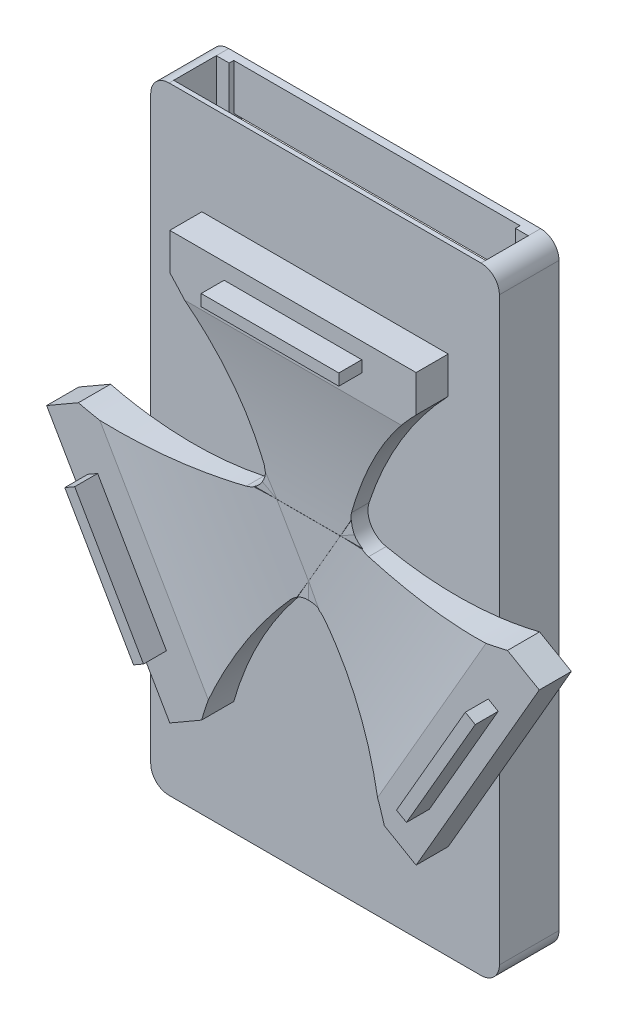
from build123d import *

# Parameters (mm, degrees)
RESSALTO_EXTRUS_O1_DEPTH = 7
RESSALTO_EXTRUS_O2_DEPTH = 5
RESSALTO_EXTRUS_O3_DEPTH = 13
CORTE_EXTRUS_O1_DEPTH    = 131
CORTE_EXTRUS_O2_DEPTH    = 60
CORTE_EXTRUS_O3_DEPTH    = 58
CORTE_EXTRUS_O4_DEPTH    = 53
CORTE_EXTRUS_O5_DEPTH    = 3.4
ESBO_O13_W               = 62.4
ESBO_O13_H               = 52.25073341
ESBO_O13_H_2             = 58.74926659
CORTE_EXTRUS_O6_DEPTH    = 3.4


with BuildPart() as part:
    # Esboço1 → Ressalto-extrusão1 (new body)
    with BuildSketch(Plane.XY):
        with BuildLine():
            Line((-26.846787517, 46.5), (26.846787517, 46.5))
            Line((26.846787517, 46.5), (26.846787517, 38.5))
            ThreePointArc((26.846787517, 38.5), (16.603731122, 25.147195766), (9.603000417, 9.843361122))
            ThreePointArc((9.603000417, 9.843361122), (10.024733627, 5.787782658), (13.326100999, 3.394761752))
            ThreePointArc((13.326100999, 3.394761752), (30.079975929, 1.805655066), (46.765371804, 4))
            Line((46.765371804, 4), (53.693575035, 0))
            Line((53.693575035, 0), (26.846787517, -46.5))
            Line((26.846787517, -46.5), (19.918584287, -42.5))
            ThreePointArc((19.918584287, -42.5), (13.476244807, -26.952850832), (3.723100582, -13.238122875))
            ThreePointArc((3.723100582, -13.238122875), (0, -11.575565317), (-3.723100582, -13.238122875))
            ThreePointArc((-3.723100582, -13.238122875), (-13.476244807, -26.952850832), (-19.918584287, -42.5))
            Line((-19.918584287, -42.5), (-26.846787517, -46.5))
            Line((-26.846787517, -46.5), (-53.693575035, 0))
            Line((-53.693575035, 0), (-46.765371804, 4))
            ThreePointArc((-46.765371804, 4), (-30.079975929, 1.805655066), (-13.326100999, 3.394761752))
            ThreePointArc((-13.326100999, 3.394761752), (-10.024733627, 5.787782658), (-9.603000417, 9.843361122))
            ThreePointArc((-9.603000417, 9.843361122), (-16.603731122, 25.147195766), (-26.846787517, 38.5))
            Line((-26.846787517, 38.5), (-26.846787517, 46.5))
        make_face()
    extrude(amount=RESSALTO_EXTRUS_O1_DEPTH)

    # Esboço2 → Ressalto-extrusão2 (add)
    with BuildSketch(Plane.XY.offset(7)):
        Polygon((37.239092363, -21.5), (44.739092363, -8.509618943), (42.574028853, -7.259618943), (27.574028853, -33.240381057), (29.739092363, -34.490381057), align=None)
        Polygon((0, 43), (-15, 43), (-15, 40.5), (15, 40.5), (15, 43), align=None)
        Polygon((-37.239092363, -21.5), (-29.739092363, -34.490381057), (-27.574028853, -33.240381057), (-42.574028853, -7.259618943), (-44.739092363, -8.509618943), align=None)
    extrude(amount=RESSALTO_EXTRUS_O2_DEPTH)

    # Esboço3 → Ressalto-extrusão3 (add)
    with BuildSketch(Plane(origin=(0, 0, 0), x_dir=(-1, 0, 0), z_dir=(0, 0, -1))):
        with BuildLine():
            Line((38, 63.25073341), (38, -63.25073341))
            ThreePointArc((38, -63.25073341), (36.828427125, -66.079160535), (34, -67.25073341))
            Line((34, -67.25073341), (-34, -67.25073341))
            ThreePointArc((-34, -67.25073341), (-36.828427125, -66.079160535), (-38, -63.25073341))
            Line((-38, -63.25073341), (-38, 63.25073341))
            ThreePointArc((-38, 63.25073341), (-36.828427125, 66.079160535), (-34, 67.25073341))
            Line((-34, 67.25073341), (34, 67.25073341))
            ThreePointArc((34, 67.25073341), (36.828427125, 66.079160535), (38, 63.25073341))
        make_face()
    extrude(amount=RESSALTO_EXTRUS_O3_DEPTH)

    # Esboço4 → Corte-extrusão1 (cut)
    with BuildSketch(Plane(origin=(0, 67.25073341, 0), x_dir=(1, 0, 0), z_dir=(0, 1, 0))):
        Polygon((0, 1), (34, 1), (34, 10.3), (31.2, 10.3), (31.2, 11.3), (-31.2, 11.3), (-31.2, 10.3), (-34, 10.3), (-34, 1), align=None)
    extrude(amount=-CORTE_EXTRUS_O1_DEPTH, mode=Mode.SUBTRACT)

    # Esboço6 → Corte-extrusão2 (cut)
    with BuildSketch(Plane.ZY.offset(26.846787517)):
        with BuildLine():
            Line((18.516337651, 34.944688344), (7, 34.944688344))
            ThreePointArc((7, 34.944688344), (4.663173788, 19.541492285), (3.576332881, 4))
            Line((3.576332881, 4), (21.222643852, 4))
            Line((21.222643852, 4), (18.516337651, 34.944688344))
        make_face()
    extrude(amount=-CORTE_EXTRUS_O2_DEPTH, mode=Mode.SUBTRACT)

    # Esboço8 → Corte-extrusão3 (cut)
    with BuildSketch(Plane(origin=(13.423393759, -23.25, 0), x_dir=(0.8660254037844386, 0.5000000000000003, 0), z_dir=(0.5000000000000003, -0.8660254037844386, 0))):
        with BuildLine():
            Line((-34.944688344, 18.516337651), (-34.944688344, 7))
            ThreePointArc((-34.944688344, 7), (-19.541492285, 4.663173788), (-4, 3.576332881))
            Line((-4, 3.576332881), (-4, 21.222643852))
            Line((-4, 21.222643852), (-34.944688344, 18.516337651))
        make_face()
    extrude(amount=-CORTE_EXTRUS_O3_DEPTH, mode=Mode.SUBTRACT)

    # Esboço10 → Corte-extrusão4 (cut)
    with BuildSketch(Plane(origin=(13.423393759, 23.25, 0), x_dir=(0.8660254037845888, -0.4999999999997399, 0), z_dir=(0.49999999999973993, 0.8660254037845889, 0))):
        with BuildLine():
            Line((34.944688344, -18.516337651), (34.944688344, -7))
            ThreePointArc((34.944688344, -7), (19.541492285, -4.663173788), (4, -3.576332881))
            Line((4, -3.576332881), (4, -21.222643852))
            Line((4, -21.222643852), (34.944688344, -18.516337651))
        make_face()
    extrude(amount=-CORTE_EXTRUS_O4_DEPTH, mode=Mode.SUBTRACT)

    # Esboço11 → Corte-extrusão5 (cut)
    with BuildSketch(Plane.XY.offset(7)):
        Polygon((-6.92820323, 4), (6.92820323, 4), (0, -8), align=None)
    extrude(amount=-CORTE_EXTRUS_O5_DEPTH, mode=Mode.SUBTRACT)

    # Esboço13 → Corte-extrusão6 (cut)
    with BuildSketch(Plane(origin=(0, 0, -13), x_dir=(-1, 0, 0), z_dir=(0, 0, -1))):
        with Locations((0, 31.125366705)):
            Rectangle(ESBO_O13_W, ESBO_O13_H)
        with Locations((0, -34.374633295)):
            Rectangle(ESBO_O13_W, ESBO_O13_H_2)
    extrude(amount=-CORTE_EXTRUS_O6_DEPTH, mode=Mode.SUBTRACT)


solid = part.part
